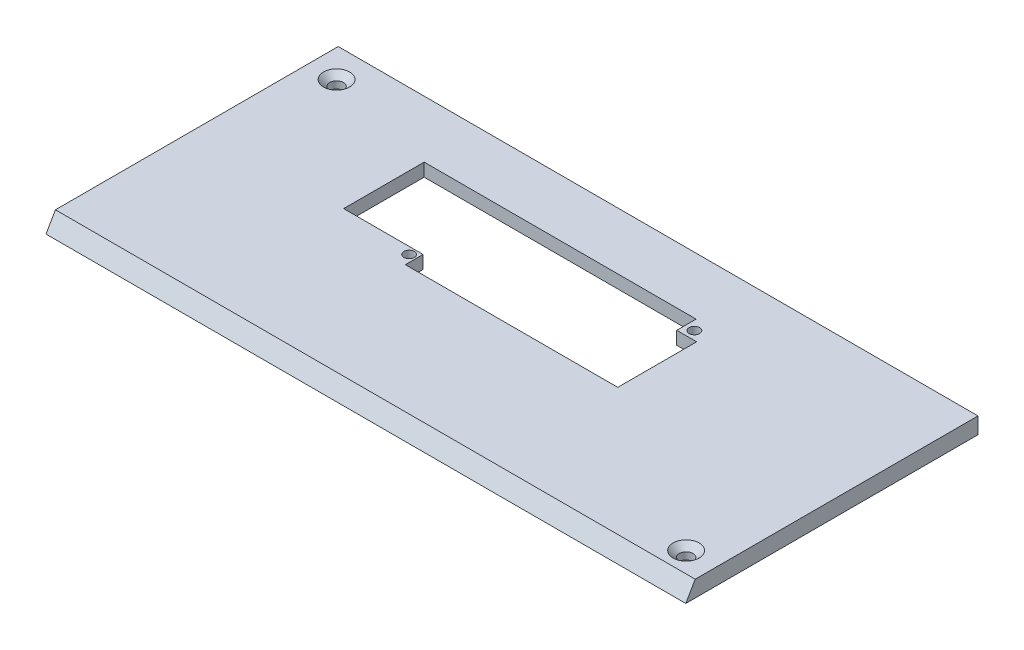
from build123d import *

# Parameters (mm, degrees)
SALIENTE_EXTRUIR1_DEPTH                              = 196
VACIADO1_T                                           = -4
SKETCH2_R                                            = 1.6
CUT_EXTRUDE1_DEPTH                                   = 4.9
SKETCH3_W                                            = 15.808220793
SKETCH3_H                                            = 24.667910986
CUT_EXTRUDE2_DEPTH                                   = 10
SKETCH4_R                                            = 1.585
CUT_EXTRUDE3_DEPTH                                   = 13
AVELLANADO_PARA_TORNILLO_CON_CABEZA_AVEL_D           = 4.2
AVELLANADO_PARA_TORNILLO_CON_CABEZA_AVEL_DEPTH       = 10
AVELLANADO_PARA_TORNILLO_CON_CABEZA_AVEL_CSINK_D     = 8
AVELLANADO_PARA_TORNILLO_CON_CABEZA_AVEL_CSINK_ANGLE = 92
AVELLANADO_PARA_TORNILLO_CON_CABEZA_AVEL_TIP         = 1.2618073


with BuildPart() as part:
    # Croquis1 → Saliente-Extruir1 (new body)
    with BuildSketch(Plane(origin=(0, 0, 0), x_dir=(0, 0, -1), z_dir=(1, 0, 0))):
        Polygon((0, 0), (89.52, 0), (89.52, 5), (2.886751346, 5), align=None)
    extrude(amount=SALIENTE_EXTRUIR1_DEPTH)

    # Vaciado1
    vaciado1_openings = [part.faces().sort_by_distance(p)[0] for p in [
        (98, 0, -44.76),
    ]]
    offset(amount=VACIADO1_T, openings=vaciado1_openings, kind=Kind.INTERSECTION)

    # Sketch2 → Cut-Extrude1 (cut)
    with BuildSketch(Plane(origin=(0, 1, 0), x_dir=(-1, 0, 0), z_dir=(0, -1, 0))):
        with Locations((-66.016866124, 45.223012087)):
            Circle(SKETCH2_R)
        with Locations((-129.916866124, 68.723012087)):
            Circle(SKETCH2_R)
        Polygon((-59.63721676, 47.355101101), (-68.161474477, 47.355101101), (-68.161474477, 41.923012087), (-133.236866124, 41.923012087), (-133.236866124, 66.093328063), (-127.135158107, 66.093328063), (-127.135158107, 72.023012087), (-59.63721676, 72.023012087), align=None)
    extrude(amount=-CUT_EXTRUDE1_DEPTH, mode=Mode.SUBTRACT)

    # Sketch3 → Cut-Extrude2 (cut)
    with BuildSketch(Plane(origin=(0, 5, 0), x_dir=(1, 0, 0), z_dir=(0, 1, 0))):
        with Locations((51.733106363, 59.689056594)):
            Rectangle(SKETCH3_W, SKETCH3_H)
    extrude(amount=-CUT_EXTRUDE2_DEPTH, mode=Mode.SUBTRACT)

    # Sketch4 → Cut-Extrude3 (cut)
    with BuildSketch(Plane(origin=(0, 1, 0), x_dir=(-1, 0, 0), z_dir=(0, -1, 0))):
        with Locations((-8.5, 80.52)):
            Circle(SKETCH4_R)
        with Locations((-187, 9.110852167)):
            Circle(SKETCH4_R)
    extrude(amount=-CUT_EXTRUDE3_DEPTH, mode=Mode.SUBTRACT)

    # Avellanado para tornillo con cabeza avellanada en cruz de M3.51
    with Locations(Plane(origin=(187, 5, -9.110852167), x_dir=(0, 0, 1), z_dir=(0, 1, 0))):
        with Locations((0, 0), (-71.409147833, -178.5)):
            CounterSinkHole(AVELLANADO_PARA_TORNILLO_CON_CABEZA_AVEL_D / 2, AVELLANADO_PARA_TORNILLO_CON_CABEZA_AVEL_CSINK_D / 2, depth=AVELLANADO_PARA_TORNILLO_CON_CABEZA_AVEL_DEPTH, counter_sink_angle=AVELLANADO_PARA_TORNILLO_CON_CABEZA_AVEL_CSINK_ANGLE)
            with Locations((0, 0, -(AVELLANADO_PARA_TORNILLO_CON_CABEZA_AVEL_DEPTH + AVELLANADO_PARA_TORNILLO_CON_CABEZA_AVEL_TIP / 2))):  # 118° drill point
                Cone(0, AVELLANADO_PARA_TORNILLO_CON_CABEZA_AVEL_D / 2, AVELLANADO_PARA_TORNILLO_CON_CABEZA_AVEL_TIP, mode=Mode.SUBTRACT)


solid = part.part
